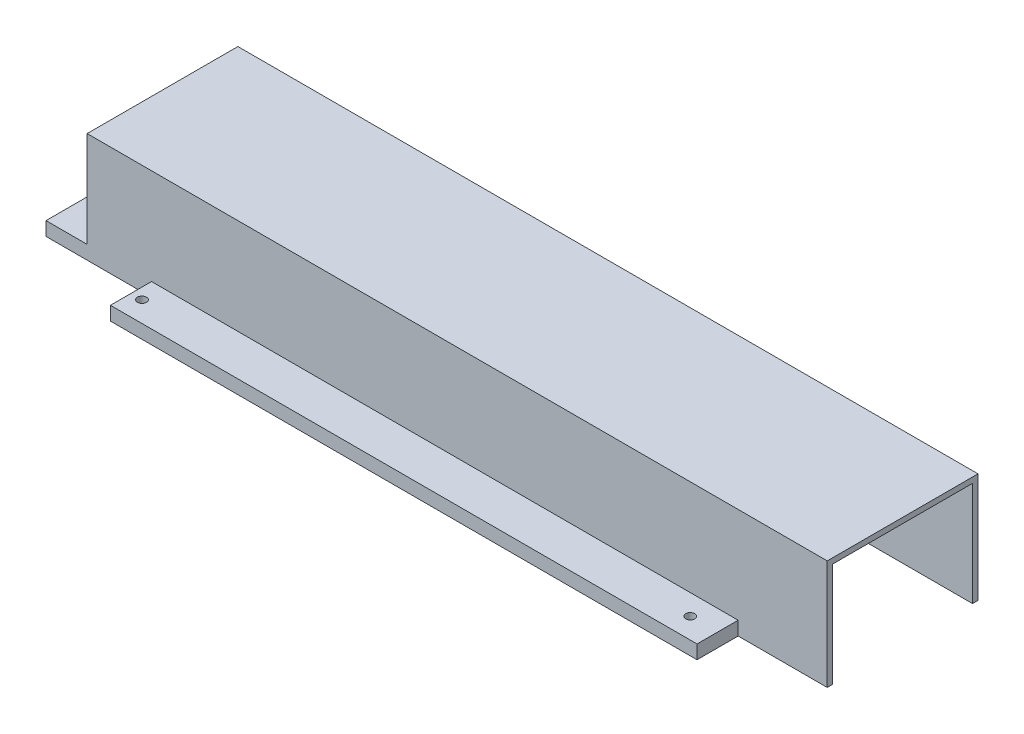
from build123d import *

# Parameters (mm, degrees)
SKETCH1_W             = 285
SKETCH1_H             = 85
SKETCH1_W_2           = 251
SKETCH1_H_2           = 51
BOSS_EXTRUDE1_DEPTH   = 5
SKETCH2_W             = 270
SKETCH2_H             = 55
SKETCH2_W_2           = 251
SKETCH2_H_2           = 51
BOSS_EXTRUDE2_DEPTH   = 35
SKETCH3_W             = 270
SKETCH3_H             = 55
BOSS_EXTRUDE3_DEPTH   = 2
SKETCH4_W             = 51
SKETCH4_H             = 38
CUT_EXTRUDE1_DEPTH    = 17
M4X0_7_TAPPED_HOLE1_D = 3.3
SKETCH8_W             = 32.5
SKETCH8_H             = 15
CUT_EXTRUDE2_DEPTH    = 10
SKETCH9_W             = 38.5
SKETCH9_H             = 15
CUT_EXTRUDE3_DEPTH    = 10


with BuildPart() as part:
    # Sketch1 → Boss-Extrude1 (new body)
    with BuildSketch(Plane(origin=(0, 0, 0), x_dir=(1, 0, 0), z_dir=(0, 1, 0))):
        Rectangle(SKETCH1_W, SKETCH1_H)
        Rectangle(SKETCH1_W_2, SKETCH1_H_2, mode=Mode.SUBTRACT)
    extrude(amount=BOSS_EXTRUDE1_DEPTH)

    # Sketch2 → Boss-Extrude2 (add)
    with BuildSketch(Plane(origin=(0, 5, 0), x_dir=(1, 0, 0), z_dir=(0, 1, 0))):
        with Locations((7.5, 0)):
            Rectangle(SKETCH2_W, SKETCH2_H)
        Rectangle(SKETCH2_W_2, SKETCH2_H_2, mode=Mode.SUBTRACT)
    extrude(amount=BOSS_EXTRUDE2_DEPTH)

    # Sketch3 → Boss-Extrude3 (add)
    with BuildSketch(Plane(origin=(0, 40, 0), x_dir=(1, 0, 0), z_dir=(0, 1, 0))):
        with Locations((7.5, 0)):
            Rectangle(SKETCH3_W, SKETCH3_H)
    extrude(amount=-BOSS_EXTRUDE3_DEPTH)

    # Sketch4 → Cut-Extrude1 (cut)
    with BuildSketch(Plane(origin=(142.5, 0, 0), x_dir=(0, 0, -1), z_dir=(1, 0, 0))):
        with Locations((0, 19)):
            Rectangle(SKETCH4_W, SKETCH4_H)
    extrude(amount=-CUT_EXTRUDE1_DEPTH, mode=Mode.SUBTRACT)

    # M4x0.7 Tapped Hole1 (through all)
    with Locations(Plane(origin=(0, 5, 0), x_dir=(1, 0, 0), z_dir=(0, 1, 0))):
        with Locations((100, 35), (-100, -35), (-100, 35), (100, -35)):
            Hole(M4X0_7_TAPPED_HOLE1_D / 2)

    # Sketch8 → Cut-Extrude2 (cut)
    with BuildSketch(Plane(origin=(0, 5, 0), x_dir=(1, 0, 0), z_dir=(0, 1, 0))):
        with Locations((126.25, 35)):
            Rectangle(SKETCH8_W, SKETCH8_H)
        with Locations((126.25, -35)):
            Rectangle(SKETCH8_W, SKETCH8_H)
    extrude(amount=-CUT_EXTRUDE2_DEPTH, mode=Mode.SUBTRACT)

    # Sketch9 → Cut-Extrude3 (cut)
    with BuildSketch(Plane(origin=(0, 5, 0), x_dir=(1, 0, 0), z_dir=(0, 1, 0))):
        with Locations((-123.25, 35)):
            Rectangle(SKETCH9_W, SKETCH9_H)
    cut_extrude3 = extrude(amount=-CUT_EXTRUDE3_DEPTH, mode=Mode.SUBTRACT)

    # Mirror1: Cut-Extrude3 across plane
    add(cut_extrude3.mirror(Plane.XY), mode=Mode.SUBTRACT)


solid = part.part
